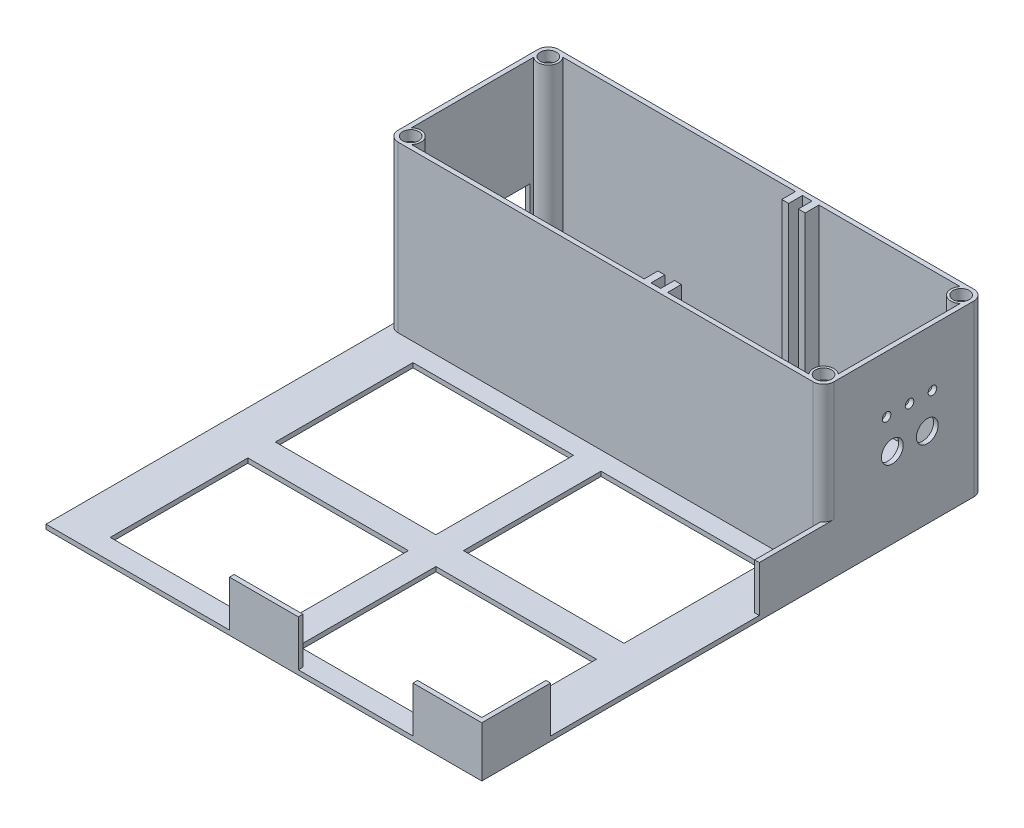
from build123d import *

# Parameters (mm, degrees)
SKETCH1_W           = 190
SKETCH1_H           = 219
BOSS_EXTRUDE1_DEPTH = 2
SKETCH4_W           = 70
SKETCH4_H           = 60
CUT_EXTRUDE1_DEPTH  = 4
SKETCH2_W           = 30
SKETCH2_H           = 2
BOSS_EXTRUDE2_DEPTH = 20
SKETCH3_W           = 190
SKETCH3_H           = 70
BOSS_EXTRUDE3_DEPTH = 72
SKETCH7_R           = 3
SKETCH7_R_2         = 4.5
BOSS_EXTRUDE4_DEPTH = 4
SKETCH8_R           = 3.5
CUT_EXTRUDE3_DEPTH  = 4
SKETCH9_R           = 2
BOSS_EXTRUDE5_DEPTH = 2
SKETCH10_R          = 0.95
CUT_EXTRUDE4_DEPTH  = 2
SKETCH11_R          = 1.875
SKETCH11_R_2        = 4.75
CUT_EXTRUDE5_DEPTH  = 4
SKETCH12_R          = 4.5
BOSS_EXTRUDE6_DEPTH = 72
SKETCH13_R          = 3.5
CUT_EXTRUDE6_DEPTH  = 4.5
FILLET1_START       = 2
FILLET1_DEPTH       = 73
FILLET1_START_2     = 22
FILLET1_2_DEPTH     = 53
FILLET1_START_3     = -1
FILLET1_3_DEPTH     = 23
SKETCH14_W          = 18
SKETCH14_H          = 15
CUT_EXTRUDE7_DEPTH  = 5
SKETCH15_R          = 2.1
BOSS_EXTRUDE7_DEPTH = 5.5


with BuildPart() as part:
    # Sketch1 → Boss-Extrude1 (new body)
    with BuildSketch(Plane(origin=(0, 0, 0), x_dir=(1, 0, 0), z_dir=(0, 1, 0))):
        with Locations((95, 109.5)):
            Rectangle(SKETCH1_W, SKETCH1_H)
    extrude(amount=BOSS_EXTRUDE1_DEPTH)

    # Sketch4 → Cut-Extrude1 (cut)
    with BuildSketch(Plane(origin=(0, 0, 0), x_dir=(1, 0, 0), z_dir=(0, 1, 0))):
        with Locations((54, 111)):
            Rectangle(SKETCH4_W, SKETCH4_H)
        with Locations((136, 111)):
            Rectangle(SKETCH4_W, SKETCH4_H)
        with Locations((136, 39)):
            Rectangle(SKETCH4_W, SKETCH4_H)
        with Locations((54, 39)):
            Rectangle(SKETCH4_W, SKETCH4_H)
    extrude(amount=CUT_EXTRUDE1_DEPTH, mode=Mode.SUBTRACT)

    # Sketch2 → Boss-Extrude2 (add)
    with BuildSketch(Plane(origin=(0, 2, 0), x_dir=(1, 0, 0), z_dir=(0, 1, 0))):
        with Locations((95, 1)):
            Rectangle(SKETCH2_W, SKETCH2_H)
        Polygon((160, 0), (190, 0), (190, 30), (188, 30), (188, 2), (160, 2), align=None)
        Polygon((190, 121), (190, 151), (156, 151), (156, 149), (188, 149), (188, 121), align=None)
    extrude(amount=BOSS_EXTRUDE2_DEPTH)

    # Sketch3 → Boss-Extrude3 (add)
    with BuildSketch(Plane(origin=(0, 2, 0), x_dir=(1, 0, 0), z_dir=(0, 1, 0))):
        with Locations((95, 184)):
            Rectangle(SKETCH3_W, SKETCH3_H)
        Polygon((188, 217), (120, 217), (120, 211), (117, 211), (117, 217), (112.8, 217), (112.8, 211), (109.8, 211), (109.8, 217), (2, 217), (2, 151), (109.8, 151), (109.8, 157), (112.8, 157), (112.8, 151), (117, 151), (117, 157), (120, 157), (120, 151), (188, 151), align=None, mode=Mode.SUBTRACT)
    extrude(amount=BOSS_EXTRUDE3_DEPTH)

    # Sketch7 → Boss-Extrude4 (add)
    with BuildSketch(Plane(origin=(0, 2, 0), x_dir=(1, 0, 0), z_dir=(0, 1, 0))):
        with Locations(Location((24, 208, 0), (0, 0, 90))):
            Circle(SKETCH7_R)
        with Locations(Location((24, 160, 0), (0, 0, 90))):
            Circle(SKETCH7_R)
        with Locations(Location((76, 193.5, 0), (0, 0, 90))):
            Circle(SKETCH7_R_2)
        with Locations(Location((76, 165.5, 0), (0, 0, 90))):
            Circle(SKETCH7_R_2)
    extrude(amount=BOSS_EXTRUDE4_DEPTH)

    # Sketch8 → Cut-Extrude3 (cut)
    with BuildSketch(Plane(origin=(0, 6, 0), x_dir=(1, 0, 0), z_dir=(0, 1, 0))):
        with Locations(Location((76, 193.5, 0), (0, 0, 270))):
            Circle(SKETCH8_R)
        with Locations(Location((76, 165.5, 0), (0, 0, 270))):
            Circle(SKETCH8_R)
    extrude(amount=-CUT_EXTRUDE3_DEPTH, mode=Mode.SUBTRACT)

    # Sketch9 → Boss-Extrude5 (add)
    with BuildSketch(Plane.ZY.offset(-188)):
        with Locations((-204.5, 55.5)):
            Circle(SKETCH9_R)
        with Locations((-163.5, 55.5)):
            Circle(SKETCH9_R)
        with Locations((-204.5, 27)):
            Circle(SKETCH9_R)
        with Locations((-163.5, 27)):
            Circle(SKETCH9_R)
    extrude(amount=BOSS_EXTRUDE5_DEPTH)

    # Sketch10 → Cut-Extrude4 (cut)
    with BuildSketch(Plane.ZY.offset(-186)):
        with Locations((-204.5, 55.5)):
            Circle(SKETCH10_R)
        with Locations((-163.5, 55.5)):
            Circle(SKETCH10_R)
        with Locations((-163.5, 27)):
            Circle(SKETCH10_R)
        with Locations((-204.5, 27)):
            Circle(SKETCH10_R)
    extrude(amount=-CUT_EXTRUDE4_DEPTH, mode=Mode.SUBTRACT)

    # Sketch11 → Cut-Extrude5 (cut)
    with BuildSketch(Plane.ZY.offset(-188)):
        with Locations((-196.5, 49.25)):
            Circle(SKETCH11_R)
        with Locations((-186.5, 49.25)):
            Circle(SKETCH11_R)
        with Locations((-176.5, 49.25)):
            Circle(SKETCH11_R)
        with Locations((-194.25, 35)):
            Circle(SKETCH11_R_2)
        with Locations((-179, 35)):
            Circle(SKETCH11_R_2)
    extrude(amount=-CUT_EXTRUDE5_DEPTH, mode=Mode.SUBTRACT)

    # Sketch12 → Boss-Extrude6 (add)
    with BuildSketch(Plane(origin=(0, 2, 0), x_dir=(1, 0, 0), z_dir=(0, 1, 0))):
        with Locations((5, 214)):
            Circle(SKETCH12_R)
        with Locations((5, 154)):
            Circle(SKETCH12_R)
        with Locations((185, 214)):
            Circle(SKETCH12_R)
        with Locations((185, 154)):
            Circle(SKETCH12_R)
    extrude(amount=BOSS_EXTRUDE6_DEPTH)

    # Sketch13 → Cut-Extrude6 (cut)
    with BuildSketch(Plane(origin=(0, 74, 0), x_dir=(1, 0, 0), z_dir=(0, 1, 0))):
        with Locations(Location((5, 214, 0), (0, 0, 270))):
            Circle(SKETCH13_R)
        with Locations(Location((5, 154, 0), (0, 0, 270))):
            Circle(SKETCH13_R)
        with Locations(Location((185, 214, 0), (0, 0, 270))):
            Circle(SKETCH13_R)
        with Locations(Location((185, 154, 0), (0, 0, 270))):
            Circle(SKETCH13_R)
    extrude(amount=-CUT_EXTRUDE6_DEPTH, mode=Mode.SUBTRACT)

    # Fillet1: read off the stored shape, not the designer's step
    # Fillet1 outline → Fillet1 (cut)
    with BuildSketch(Plane(origin=(0, 0, 0), x_dir=(1, 0, 0), z_dir=(0, 1, 0)).offset(FILLET1_START)):
        with BuildLine():
            Line((0, 149), (4.5, 149))
            ThreePointArc((4.5, 149), (1.318019485, 150.318019485), (0, 153.5))
            Line((0, 153.5), (0, 149))
        make_face()
        with BuildLine():
            ThreePointArc((188, 149.758342614), (186.80624304, 149.19375696), (185.5, 149))
            Line((185.5, 149), (188, 149))
            Line((188, 149), (188, 149.758342614))
        make_face()
        with BuildLine():
            Line((0, 219), (0, 214.5))
            ThreePointArc((0, 214.5), (1.318019485, 217.681980515), (4.5, 219))
            Line((4.5, 219), (0, 219))
        make_face()
        with BuildLine():
            Line((190, 219), (185.5, 219))
            ThreePointArc((185.5, 219), (188.681980515, 217.681980515), (190, 214.5))
            Line((190, 214.5), (190, 219))
        make_face()
    extrude(amount=FILLET1_DEPTH, mode=Mode.SUBTRACT)

    # Fillet1 2 outline → Fillet1 2 (cut)
    with BuildSketch(Plane(origin=(0, 0, 0), x_dir=(1, 0, 0), z_dir=(0, 1, 0)).offset(FILLET1_START_2)):
        with BuildLine():
            ThreePointArc((190, 153.5), (189.468626966, 151.378679657), (188, 149.758342614))
            Line((188, 149.758342614), (188, 149))
            Line((188, 149), (190, 149))
            Line((190, 149), (190, 153.5))
        make_face()
    extrude(amount=FILLET1_2_DEPTH, mode=Mode.SUBTRACT)

    # Fillet1 3 outline → Fillet1 3 (cut)
    with BuildSketch(Plane(origin=(0, 0, 0), x_dir=(1, 0, 0), z_dir=(0, 1, 0)).offset(FILLET1_START_3)):
        with BuildLine():
            Line((0, 219), (0, 214.5))
            ThreePointArc((0, 214.5), (1.318019485, 217.681980515), (4.5, 219))
            Line((4.5, 219), (0, 219))
        make_face()
        with BuildLine():
            Line((190, 219), (185.5, 219))
            ThreePointArc((185.5, 219), (188.681980515, 217.681980515), (190, 214.5))
            Line((190, 214.5), (190, 219))
        make_face()
    extrude(amount=FILLET1_3_DEPTH, mode=Mode.SUBTRACT)

    # Sketch14 → Cut-Extrude7 (cut)
    with BuildSketch(Plane.ZY):
        with Locations((-200, 19.5)):
            Rectangle(SKETCH14_W, SKETCH14_H)
    extrude(amount=-CUT_EXTRUDE7_DEPTH, mode=Mode.SUBTRACT)

    # Sketch15 → Boss-Extrude7 (add)
    with BuildSketch(Plane(origin=(0, 6, 0), x_dir=(1, 0, 0), z_dir=(0, 1, 0))):
        with Locations(Location((24, 208, 0), (0, 0, 270))):
            Circle(SKETCH15_R)
        with Locations(Location((24, 160, 0), (0, 0, 270))):
            Circle(SKETCH15_R)
    extrude(amount=BOSS_EXTRUDE7_DEPTH)


solid = part.part
